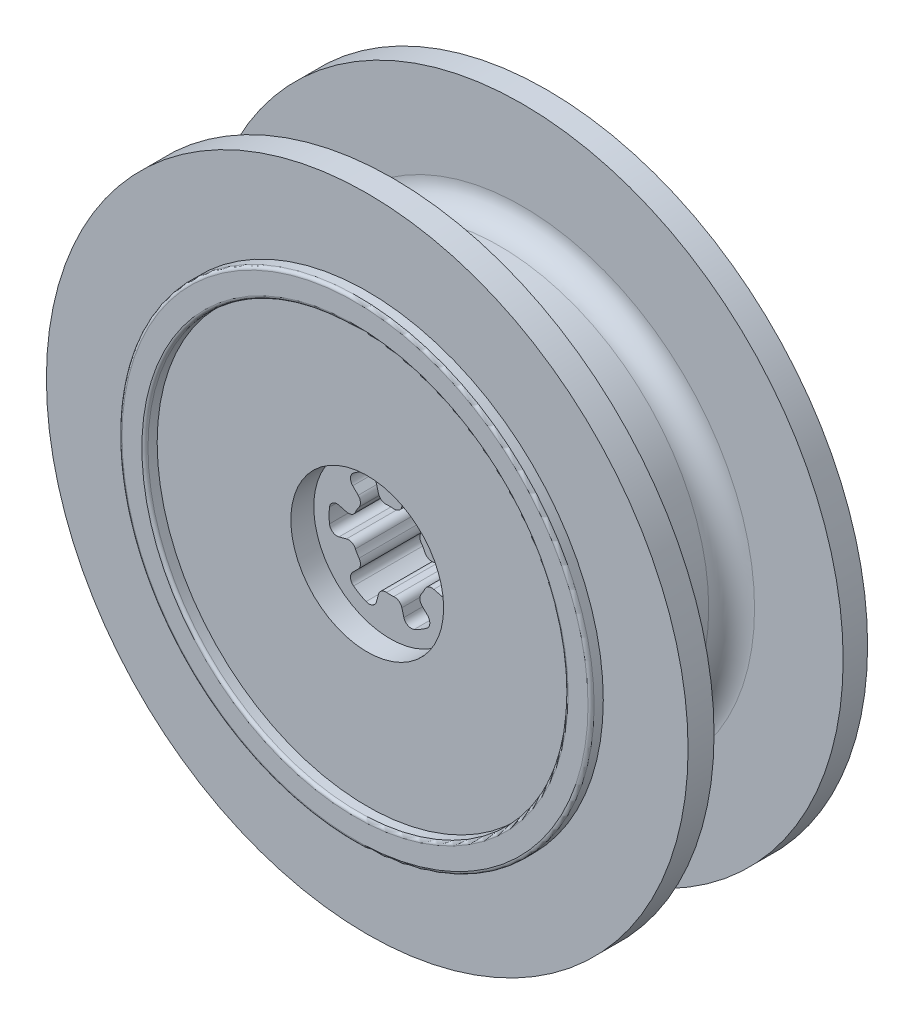
from build123d import *

# Parameters (mm, degrees)
SKETCH1_R           = 21
BOSS_EXTRUDE1_DEPTH = 1.7
SKETCH1_7_R         = 15.45
SKETCH1_7_R_2       = 13.75
BOSS_EXTRUDE2_DEPTH = 0.75
SKETCH3_R           = 13.7
SKETCH3_R_2         = 12
BOSS_EXTRUDE3_DEPTH = 8.45
BOSS_EXTRUDE5_START = 1.6
SKETCH6_R           = 21
SKETCH6_R_2         = 12.017421607
BOSS_EXTRUDE5_DEPTH = 1.6
BOSS_EXTRUDE6_START = -16.85
SKETCH7_R           = 5
BOSS_EXTRUDE6_DEPTH = 16.85
BOSS_EXTRUDE7_DEPTH = 10.04
CUT_EXTRUDE1_START  = -1.5
SKETCH9_R           = 5
CUT_EXTRUDE1_DEPTH  = 1.5
FILLET2_R           = 0.5
FILLET3_R           = 1.5
SKETCH1_9_R         = 15.45
SKETCH1_9_R_2       = 13.75
BOSS_EXTRUDE8_DEPTH = 2.5
FILLET4_R           = 0.2


with BuildPart() as part:
    # Sketch1 → Boss-Extrude1 (new body)
    with BuildSketch(Plane.XY):
        Circle(SKETCH1_R)
        with BuildLine():
            ThreePointArc((-0.647047613, 2.414814566), (0, 2.5), (0.647047613, 2.414814566))
            Line((0.647047613, 2.414814566), (1.03527618, 3.863703305))
            ThreePointArc((1.03527618, 3.863703305), (2, 3.464101615), (2.828427125, 2.828427125))
            Line((2.828427125, 2.828427125), (1.767766953, 1.767766953))
            ThreePointArc((1.767766953, 1.767766953), (2.165063509, 1.25), (2.414814566, 0.647047613))
            Line((2.414814566, 0.647047613), (3.863703305, 1.03527618))
            ThreePointArc((3.863703305, 1.03527618), (4, 0), (3.863703305, -1.03527618))
            Line((3.863703305, -1.03527618), (2.414814566, -0.647047613))
            ThreePointArc((2.414814566, -0.647047613), (2.165063509, -1.25), (1.767766953, -1.767766953))
            Line((1.767766953, -1.767766953), (2.828427125, -2.828427125))
            ThreePointArc((2.828427125, -2.828427125), (2, -3.464101615), (1.03527618, -3.863703305))
            Line((1.03527618, -3.863703305), (0.647047613, -2.414814566))
            ThreePointArc((0.647047613, -2.414814566), (0, -2.5), (-0.647047613, -2.414814566))
            Line((-0.647047613, -2.414814566), (-1.03527618, -3.863703305))
            ThreePointArc((-1.03527618, -3.863703305), (-2, -3.464101615), (-2.828427125, -2.828427125))
            Line((-2.828427125, -2.828427125), (-1.767766953, -1.767766953))
            ThreePointArc((-1.767766953, -1.767766953), (-2.165063509, -1.25), (-2.414814566, -0.647047613))
            Line((-2.414814566, -0.647047613), (-3.863703305, -1.03527618))
            ThreePointArc((-3.863703305, -1.03527618), (-4, 0), (-3.863703305, 1.03527618))
            Line((-3.863703305, 1.03527618), (-2.414814566, 0.647047613))
            ThreePointArc((-2.414814566, 0.647047613), (-2.165063509, 1.25), (-1.767766953, 1.767766953))
            Line((-1.767766953, 1.767766953), (-2.828427125, 2.828427125))
            ThreePointArc((-2.828427125, 2.828427125), (-2, 3.464101615), (-1.03527618, 3.863703305))
            Line((-1.03527618, 3.863703305), (-0.647047613, 2.414814566))
        make_face(mode=Mode.SUBTRACT)
    extrude(amount=BOSS_EXTRUDE1_DEPTH)

    # Sketch1<7> → Boss-Extrude2 (add)
    with BuildSketch(Plane.XY):
        Circle(SKETCH1_7_R)
        Circle(SKETCH1_7_R_2, mode=Mode.SUBTRACT)
    extrude(amount=BOSS_EXTRUDE2_DEPTH)

    # Sketch3 → Boss-Extrude3 (add)
    with BuildSketch(Plane(origin=(0, 0, 0), x_dir=(-1, 0, 0), z_dir=(0, 0, -1))):
        Circle(SKETCH3_R)
        Circle(SKETCH3_R_2, mode=Mode.SUBTRACT)
    extrude(amount=BOSS_EXTRUDE3_DEPTH)

    # Sketch6 → Boss-Extrude5 (add)
    with BuildSketch(Plane(origin=(0, 0, -8.45), x_dir=(-1, 0, 0), z_dir=(0, 0, -1)).offset(BOSS_EXTRUDE5_START)):
        Circle(SKETCH6_R)
        Circle(SKETCH6_R_2, mode=Mode.SUBTRACT)
    extrude(amount=-BOSS_EXTRUDE5_DEPTH)

    # Sketch7 → Boss-Extrude6 (add)
    with BuildSketch(Plane.XY.offset(1.7).offset(BOSS_EXTRUDE6_START)):
        Circle(SKETCH7_R)
        with BuildLine():
            ThreePointArc((-0.647047613, 2.414814566), (0, 2.5), (0.647047613, 2.414814566))
            Line((0.647047613, 2.414814566), (1.03527618, 3.863703305))
            ThreePointArc((1.03527618, 3.863703305), (2, 3.464101615), (2.828427125, 2.828427125))
            Line((2.828427125, 2.828427125), (1.767766953, 1.767766953))
            ThreePointArc((1.767766953, 1.767766953), (2.165063509, 1.25), (2.414814566, 0.647047613))
            Line((2.414814566, 0.647047613), (3.863703305, 1.03527618))
            ThreePointArc((3.863703305, 1.03527618), (4, 0), (3.863703305, -1.03527618))
            Line((3.863703305, -1.03527618), (2.414814566, -0.647047613))
            ThreePointArc((2.414814566, -0.647047613), (2.165063509, -1.25), (1.767766953, -1.767766953))
            Line((1.767766953, -1.767766953), (2.828427125, -2.828427125))
            ThreePointArc((2.828427125, -2.828427125), (2, -3.464101615), (1.03527618, -3.863703305))
            Line((1.03527618, -3.863703305), (0.647047613, -2.414814566))
            ThreePointArc((0.647047613, -2.414814566), (0, -2.5), (-0.647047613, -2.414814566))
            Line((-0.647047613, -2.414814566), (-1.03527618, -3.863703305))
            ThreePointArc((-1.03527618, -3.863703305), (-2, -3.464101615), (-2.828427125, -2.828427125))
            Line((-2.828427125, -2.828427125), (-1.767766953, -1.767766953))
            ThreePointArc((-1.767766953, -1.767766953), (-2.165063509, -1.25), (-2.414814566, -0.647047613))
            Line((-2.414814566, -0.647047613), (-3.863703305, -1.03527618))
            ThreePointArc((-3.863703305, -1.03527618), (-4, 0), (-3.863703305, 1.03527618))
            Line((-3.863703305, 1.03527618), (-2.414814566, 0.647047613))
            ThreePointArc((-2.414814566, 0.647047613), (-2.165063509, 1.25), (-1.767766953, 1.767766953))
            Line((-1.767766953, 1.767766953), (-2.828427125, 2.828427125))
            ThreePointArc((-2.828427125, 2.828427125), (-2, 3.464101615), (-1.03527618, 3.863703305))
            Line((-1.03527618, 3.863703305), (-0.647047613, 2.414814566))
        make_face(mode=Mode.SUBTRACT)
    extrude(amount=BOSS_EXTRUDE6_DEPTH)

    # Sketch8 → Boss-Extrude7 (add)
    with BuildSketch(Plane(origin=(0, 0, 0), x_dir=(-1, 0, 0), z_dir=(0, 0, -1))):
        with BuildLine():
            Line((-0.7, 11.979565935), (-0.7, 4.950757518))
            ThreePointArc((-0.7, 4.950757518), (0, 5), (0.7, 4.950757518))
            Line((0.7, 4.950757518), (0.7, 11.979565935))
            ThreePointArc((0.7, 11.979565935), (0, 12), (-0.7, 11.979565935))
        make_face()
        with BuildLine():
            Line((-3.937481778, 3.081596542), (-10.024608426, 6.59600075))
            ThreePointArc((-10.024608426, 6.59600075), (-10.392304845, 6), (-10.724608426, 5.383565185))
            Line((-10.724608426, 5.383565185), (-4.637481778, 1.869160976))
            ThreePointArc((-4.637481778, 1.869160976), (-4.330127019, 2.5), (-3.937481778, 3.081596542))
        make_face()
        with BuildLine():
            ThreePointArc((10.724608426, 5.383565185), (10.392304845, 6), (10.024608426, 6.59600075))
            Line((10.024608426, 6.59600075), (3.937481778, 3.081596542))
            ThreePointArc((3.937481778, 3.081596542), (4.330127019, 2.5), (4.637481778, 1.869160976))
            Line((4.637481778, 1.869160976), (10.724608426, 5.383565185))
        make_face()
        with BuildLine():
            Line((-4.637481778, -1.869160976), (-10.724608426, -5.383565185))
            ThreePointArc((-10.724608426, -5.383565185), (-10.392304845, -6), (-10.024608426, -6.59600075))
            Line((-10.024608426, -6.59600075), (-3.937481778, -3.081596542))
            ThreePointArc((-3.937481778, -3.081596542), (-4.330127019, -2.5), (-4.637481778, -1.869160976))
        make_face()
        with BuildLine():
            ThreePointArc((10.024608426, -6.59600075), (10.392304845, -6), (10.724608426, -5.383565185))
            Line((10.724608426, -5.383565185), (4.637481778, -1.869160976))
            ThreePointArc((4.637481778, -1.869160976), (4.330127019, -2.5), (3.937481778, -3.081596542))
            Line((3.937481778, -3.081596542), (10.024608426, -6.59600075))
        make_face()
        with BuildLine():
            Line((-0.7, -4.950757518), (-0.7, -11.979565935))
            ThreePointArc((-0.7, -11.979565935), (0, -12), (0.7, -11.979565935))
            Line((0.7, -11.979565935), (0.7, -4.950757518))
            ThreePointArc((0.7, -4.950757518), (0, -5), (-0.7, -4.950757518))
        make_face()
    extrude(amount=BOSS_EXTRUDE7_DEPTH)

    # Sketch9 → Cut-Extrude1 (cut)
    with BuildSketch(Plane.XY.offset(1.7).offset(CUT_EXTRUDE1_START)):
        Circle(SKETCH9_R)
        with BuildLine():
            ThreePointArc((-0.647047613, 2.414814566), (0, 2.5), (0.647047613, 2.414814566))
            Line((0.647047613, 2.414814566), (1.03527618, 3.863703305))
            ThreePointArc((1.03527618, 3.863703305), (2, 3.464101615), (2.828427125, 2.828427125))
            Line((2.828427125, 2.828427125), (1.767766953, 1.767766953))
            ThreePointArc((1.767766953, 1.767766953), (2.165063509, 1.25), (2.414814566, 0.647047613))
            Line((2.414814566, 0.647047613), (3.863703305, 1.03527618))
            ThreePointArc((3.863703305, 1.03527618), (4, 0), (3.863703305, -1.03527618))
            Line((3.863703305, -1.03527618), (2.414814566, -0.647047613))
            ThreePointArc((2.414814566, -0.647047613), (2.165063509, -1.25), (1.767766953, -1.767766953))
            Line((1.767766953, -1.767766953), (2.828427125, -2.828427125))
            ThreePointArc((2.828427125, -2.828427125), (2, -3.464101615), (1.03527618, -3.863703305))
            Line((1.03527618, -3.863703305), (0.647047613, -2.414814566))
            ThreePointArc((0.647047613, -2.414814566), (0, -2.5), (-0.647047613, -2.414814566))
            Line((-0.647047613, -2.414814566), (-1.03527618, -3.863703305))
            ThreePointArc((-1.03527618, -3.863703305), (-2, -3.464101615), (-2.828427125, -2.828427125))
            Line((-2.828427125, -2.828427125), (-1.767766953, -1.767766953))
            ThreePointArc((-1.767766953, -1.767766953), (-2.165063509, -1.25), (-2.414814566, -0.647047613))
            Line((-2.414814566, -0.647047613), (-3.863703305, -1.03527618))
            ThreePointArc((-3.863703305, -1.03527618), (-4, 0), (-3.863703305, 1.03527618))
            Line((-3.863703305, 1.03527618), (-2.414814566, 0.647047613))
            ThreePointArc((-2.414814566, 0.647047613), (-2.165063509, 1.25), (-1.767766953, 1.767766953))
            Line((-1.767766953, 1.767766953), (-2.828427125, 2.828427125))
            ThreePointArc((-2.828427125, 2.828427125), (-2, 3.464101615), (-1.03527618, 3.863703305))
            Line((-1.03527618, 3.863703305), (-0.647047613, 2.414814566))
        make_face(mode=Mode.SUBTRACT)
    extrude(amount=CUT_EXTRUDE1_DEPTH, mode=Mode.SUBTRACT)

    # Fillet2
    fillet2_edges = [part.edges().sort_by_distance(p)[0] for p in [
        (3.863703305, -1.03527618, -7.475),
        (-3.863703305, 1.03527618, -7.475),
        (3.863703305, 1.03527618, -7.475),
        (-3.863703305, -1.03527618, -7.475),
        (2.828427125, 2.828427125, -7.475),
        (-2.828427125, -2.828427125, -7.475),
        (1.767766953, 1.767766953, -7.475),
        (-1.767766953, -1.767766953, -7.475),
        (2.414814566, 0.647047613, -7.475),
        (-2.414814566, -0.647047613, -7.475),
        (1.767766953, -1.767766953, -7.475),
        (-1.767766953, 1.767766953, -7.475),
        (2.828427125, -2.828427125, -7.475),
        (-2.828427125, 2.828427125, -7.475),
        (1.03527618, -3.863703305, -7.475),
        (-1.03527618, 3.863703305, -7.475),
        (2.414814566, -0.647047613, -7.475),
        (-2.414814566, 0.647047613, -7.475),
        (0.647047613, -2.414814566, -7.475),
        (-0.647047613, 2.414814566, -7.475),
        (0.647047613, 2.414814566, -7.475),
        (-0.647047613, -2.414814566, -7.475),
        (1.03527618, 3.863703305, -7.475),
        (-1.03527618, -3.863703305, -7.475),
    ]]
    fillet(fillet2_edges, radius=FILLET2_R)

    # Fillet3
    fillet3_edges = [part.edges().sort_by_distance(p)[0] for p in [
        (13.7, 0, -8.45),
        (13.7, 0, 0),
    ]]
    fillet(fillet3_edges, radius=FILLET3_R)

    # Sketch1<9> → Boss-Extrude8 (add)
    with BuildSketch(Plane.XY):
        Circle(SKETCH1_9_R)
        Circle(SKETCH1_9_R_2, mode=Mode.SUBTRACT)
    extrude(amount=BOSS_EXTRUDE8_DEPTH)

    # Fillet4
    fillet4_edges = [part.edges().sort_by_distance(p)[0] for p in [
        (-13.75, 0, 2.5),
        (-15.45, 0, 2.5),
    ]]
    fillet(fillet4_edges, radius=FILLET4_R)


solid = part.part
